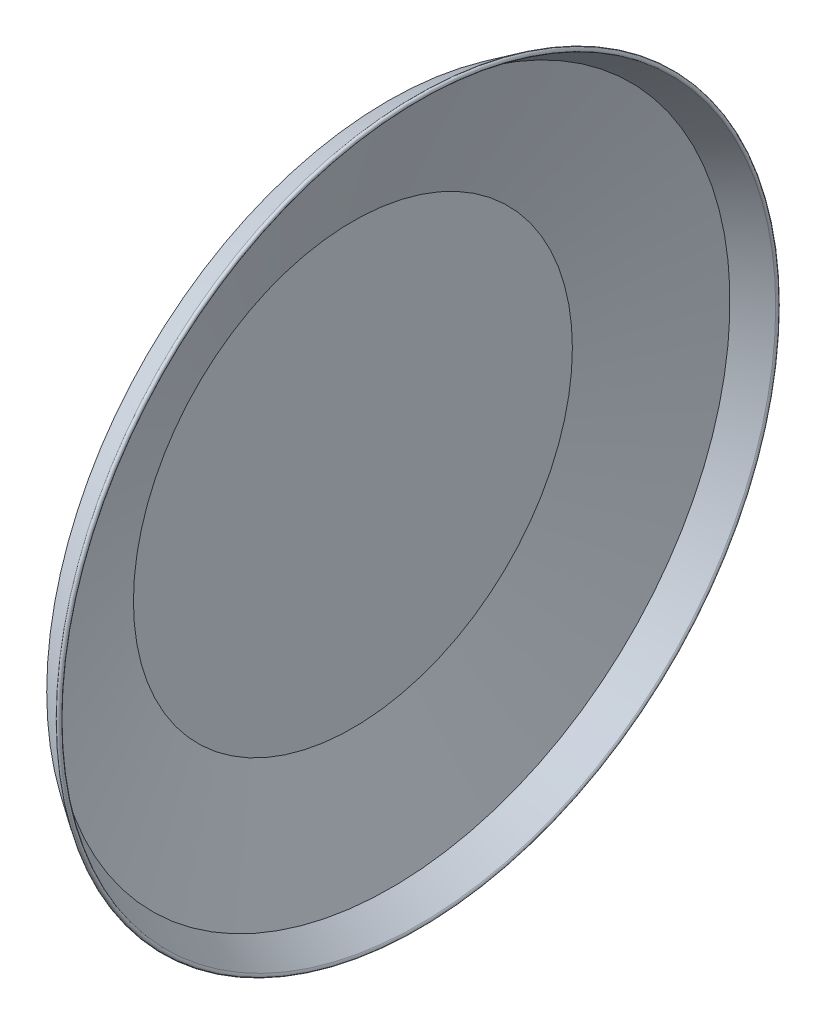
from build123d import *


with BuildPart() as part:
    # Sketch1 → Revolve2 (revolve)
    with BuildSketch(Plane.XY):
        with BuildLine():
            Line((-67.014769385, 0), (-67.014769385, 51.918667154))
            Line((-67.014769385, 51.918667154), (-57.763155546, 80.464681925))
            Line((-57.763155546, 80.464681925), (-51.024968691, 85))
            ThreePointArc((-51.024968691, 85), (-50.330986633, 84.86439431), (-50.466592322, 84.170412252))
            Line((-50.466592322, 84.170412252), (-56.918325863, 79.827899292))
            Line((-56.918325863, 79.827899292), (-66.014769385, 51.760665223))
            Line((-66.014769385, 51.760665223), (-66.014769385, 0))
            Line((-66.014769385, 0), (-67.014769385, 0))
        make_face()
    revolve(axis=Axis((-67.014769385, 0, 0), (1, 0, 0)))


solid = part.part
